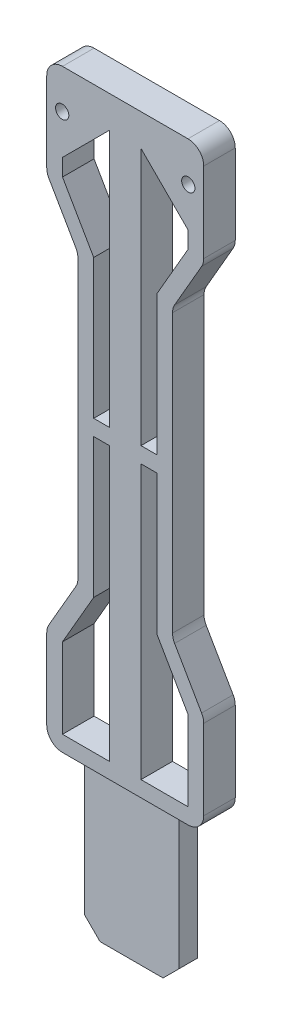
from build123d import *

# Parameters (mm, degrees)
SKETCH_1_W          = 49.8
SKETCH_1_H          = 188.5
EXTRUDE_1_DEPTH     = 5
CUT_EXTRUDE_1_DEPTH = 98.995267743
FILLET_1_R          = 5
CUT_EXTRUDE_2_DEPTH = 98.995267743
CHAMFER_2_SIZE      = 20
SKETCH_3_W          = 30
SKETCH_3_H          = 6
EXTRUDE_2_DEPTH     = 48
CHAMFER_3_SIZE      = 5
SKETCH_6_R          = 2.1
CUT_EXTRUDE_6_DEPTH = 145.758669861
SKETCH_7_R          = 3.7
CUT_EXTRUDE_7_DEPTH = 5


with BuildPart() as part:
    # 草图1 → 凸台-拉伸1 (new, symmetric)
    with BuildSketch(Plane.XY):
        Rectangle(SKETCH_1_W, SKETCH_1_H)
    extrude(amount=EXTRUDE_1_DEPTH, both=True)

    # 草图4 → 切除-拉伸1 (cut, through all)
    with BuildSketch(Plane(origin=(0, 0, -5), x_dir=(-1, 0, 0), z_dir=(0, 0, -1))):
        Polygon((-24.9, 62.5), (-15, 45.352697005), (-15, -45.352697005), (-24.9, -62.5), align=None)
        Polygon((24.9, -62.5), (24.9, 62.5), (15, 45.352697005), (15, -45.352697005), align=None)
    extrude(amount=-CUT_EXTRUDE_1_DEPTH, mode=Mode.SUBTRACT)

    # 圆角1
    fillet_1_edges = [part.edges().sort_by_distance(p)[0] for p in [
        (24.9, -62.5, 0),
        (24.9, 62.5, 0),
        (15, 45.352697005, 0),
        (15, -45.352697005, 0),
        (-24.9, -62.5, 0),
        (-15, -45.352697005, 0),
        (-15, 45.352697005, 0),
        (-24.9, 62.5, 0),
        (24.9, -94.25, 0),
        (-24.9, -94.25, 0),
        (-24.9, 94.25, 0),
        (24.9, 94.25, 0),
    ]]
    fillet(fillet_1_edges, radius=FILLET_1_R)

    # 草图5 → 切除-拉伸2 (cut, through all)
    with BuildSketch(Plane(origin=(0, 0, -5), x_dir=(-1, 0, 0), z_dir=(0, 0, -1))):
        Polygon((-19.9, 89.25), (-19.9, 63.839745962), (-10, 46.692442967), (-10, 2.5), (-5, 2.5), (-5, 89.25), align=None)
        Polygon((5, 89.25), (19.9, 89.25), (19.9, 63.839745962), (10, 46.692442967), (10, 2.5), (5, 2.5), align=None)
        Polygon((19.9, -89.25), (19.9, -63.839745962), (10, -46.692442967), (10, -2.5), (5, -2.5), (5, -89.25), align=None)
        Polygon((-5, -89.25), (-19.9, -89.25), (-19.9, -63.839745962), (-10, -46.692442967), (-10, -2.5), (-5, -2.5), align=None)
    extrude(amount=-CUT_EXTRUDE_2_DEPTH, mode=Mode.SUBTRACT)

    # 倒角2
    # the kernel refuses this chamfer: 20 mm, written as the material it adds along each edge
    with BuildSketch(Plane(origin=(-19.9, 89.25, -5), x_dir=(-0.027495876610586317, -0.9996219169112968, 0), z_dir=(0, 0, 1))) as chamfer_2_piece_1:
        Polygon((CHAMFER_2_SIZE * 0.999621916911, CHAMFER_2_SIZE * 0.0274958766106), (-CHAMFER_2_SIZE * 0.0274958766106, CHAMFER_2_SIZE * 0.999621916911), (0, 0), align=None)
    extrude(amount=10)
    with BuildSketch(Plane(origin=(19.9, 89.25, -5), x_dir=(0.027495876610586317, -0.9996219169112968, 0), z_dir=(0, 0, 1))) as chamfer_2_piece_2:
        Polygon((CHAMFER_2_SIZE * 0.999621916911, -CHAMFER_2_SIZE * 0.0274958766106), (-CHAMFER_2_SIZE * 0.0274958766106, -CHAMFER_2_SIZE * 0.999621916911), (0, 0), align=None)
    extrude(amount=10)

    # 草图3 → 凸台-拉伸2 (add)
    with BuildSketch(Plane.XZ.offset(94.25)):
        Rectangle(SKETCH_3_W, SKETCH_3_H)
    extrude(amount=EXTRUDE_2_DEPTH)

    # 倒角3
    chamfer_3_edges = [part.edges().sort_by_distance(p)[0] for p in [
        (15, -142.25, 0),
        (-15, -142.25, 0),
    ]]
    chamfer(chamfer_3_edges, length=CHAMFER_3_SIZE)

    # 草图6 → 切除-拉伸6 (cut, through all)
    with BuildSketch(Plane.XY.offset(5)):
        with Locations((-20, 81.75)):
            Circle(SKETCH_6_R)
        with Locations(Location((20, 81.75, 0), (0, 0, 180))):
            Circle(SKETCH_6_R)
    extrude(amount=-CUT_EXTRUDE_6_DEPTH, mode=Mode.SUBTRACT)

    # 草图7 → 切除-拉伸7 (cut)
    with BuildSketch(Plane(origin=(0, 0, -5), x_dir=(-1, 0, 0), z_dir=(0, 0, -1))):
        with Locations((20, 81.75)):
            Circle(SKETCH_7_R)
        with Locations((-20, 81.75)):
            Circle(SKETCH_7_R)
    extrude(amount=-CUT_EXTRUDE_7_DEPTH, mode=Mode.SUBTRACT)


solid = part.part
